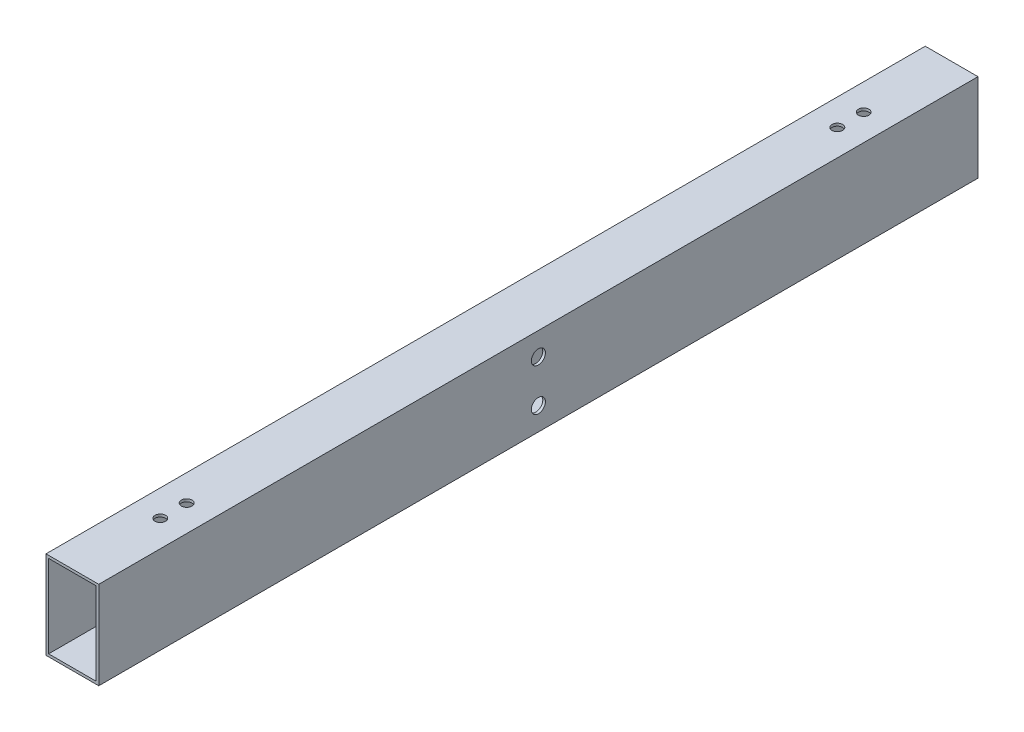
from build123d import *

# Parameters (mm, degrees)
SZKIC1_W                    = 30
SZKIC1_H                    = 50
DODANIE_WYCI_GNI_CIE1_DEPTH = 500
SZKIC2_W                    = 27
SZKIC2_H                    = 47
WYTNIJ_WYCI_GNI_CIE7_DEPTH  = 504.388517946
SZKIC5_R                    = 3
WYTNIJ_WYCI_GNI_CIE13_DEPTH = 504.388517946
SZKIC6_R                    = 4
WYTNIJ_WYCI_GNI_CIE14_DEPTH = 504.388517946


with BuildPart() as part:
    # Szkic1 → Dodanie-wyciągnięcie1 (new body)
    with BuildSketch(Plane.XY):
        with Locations((15, 25)):
            Rectangle(SZKIC1_W, SZKIC1_H)
    extrude(amount=DODANIE_WYCI_GNI_CIE1_DEPTH)

    # Szkic2 → Wytnij-wyciągnięcie7 (cut, through all)
    with BuildSketch(Plane.XY):
        with Locations((15, 25)):
            Rectangle(SZKIC2_W, SZKIC2_H)
    extrude(amount=WYTNIJ_WYCI_GNI_CIE7_DEPTH, mode=Mode.SUBTRACT)

    # Szkic5 → Wytnij-wyciągnięcie13 (cut, through all)
    with BuildSketch(Plane(origin=(0, 0, 0), x_dir=(1, 0, 0), z_dir=(0, 1, 0))):
        with Locations((15, -450)):
            Circle(SZKIC5_R)
        with Locations((15, -435)):
            Circle(SZKIC5_R)
        with Locations((15, -50)):
            Circle(SZKIC5_R)
        with Locations((15, -65)):
            Circle(SZKIC5_R)
    extrude(amount=WYTNIJ_WYCI_GNI_CIE13_DEPTH, mode=Mode.SUBTRACT)

    # Szkic6 → Wytnij-wyciągnięcie14 (cut, through all)
    with BuildSketch(Plane(origin=(30, 0, 0), x_dir=(0, 0, -1), z_dir=(1, 0, 0))):
        with Locations((-250, 37)):
            Circle(SZKIC6_R)
        with Locations((-250, 13)):
            Circle(SZKIC6_R)
    extrude(amount=-WYTNIJ_WYCI_GNI_CIE14_DEPTH, mode=Mode.SUBTRACT)


solid = part.part
